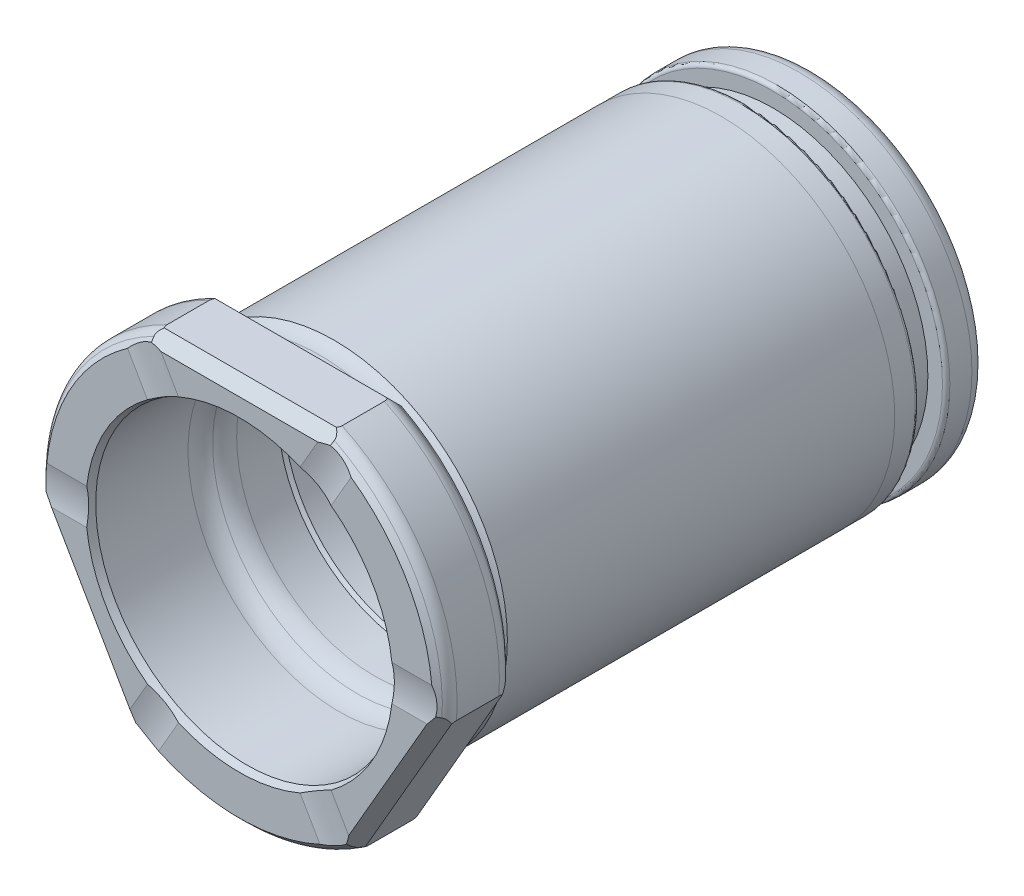
from build123d import *

# Parameters (mm, degrees)
CUT_EXTRUDE1_REACH = 89.606
SKETCH2_R          = 10
CIRPATTERN1_COUNT  = 6
CUT_EXTRUDE2_REACH = 89.606
SKETCH3_W          = 30
SKETCH3_H          = 4
CIRPATTERN2_COUNT  = 3
CHAMFER1_SIZE      = 1.5


with BuildPart() as part:
    # Sketch1 → Revolve1 (revolve)
    with BuildSketch(Plane(origin=(0, 0, 0), x_dir=(0, 0, -1), z_dir=(1, 0, 0)), mode=Mode.PRIVATE) as revolve1_sk:
        with BuildLine():
            Line((0, 26.25), (0, 20.863970234))
            Line((0, 20.863970234), (1, 20.5))
            Line((1, 20.5), (13.53731556, 20.5))
            ThreePointArc((13.53731556, 20.5), (14.84374197, 20.269832382), (16.003050742, 19.625060896))
            ThreePointArc((16.003050742, 19.625060896), (17.125121656, 18.993710669), (18.38963394, 18.751522873))
            Line((18.38963394, 18.751522873), (24, 18.751522873))
            Line((24, 18.751522873), (24.539392542, 18.5))
            Line((24.539392542, 18.5), (58.999857479, 18.5))
            ThreePointArc((58.999857479, 18.5), (59.853654168, 18.853654168), (59.5, 17.999857479))
            Line((59.5, 17.999857479), (59.5, 15.8))
            Line((59.5, 15.8), (61, 15.8))
            Line((61, 15.8), (61, 15.15))
            Line((61, 15.15), (62.5, 15.15))
            Line((62.5, 15.15), (62.5, 18.75))
            Line((62.5, 18.75), (65.7, 18.75))
            Line((65.7, 18.75), (65.7, 15.15))
            Line((65.7, 15.15), (68.5, 15.15))
            Line((68.5, 15.15), (68.5, 18.5))
            Line((68.5, 18.5), (73.5, 18.5))
            Line((73.5, 18.5), (73.5, 15.8))
            Line((73.5, 15.8), (76, 15.8))
            Line((76, 15.8), (76.55, 15.25))
            Line((76.55, 15.25), (78.5, 15.25))
            Line((78.5, 15.25), (78.5, 20))
            Line((78.5, 20), (78, 20))
            Line((78, 20), (78, 21.48))
            ThreePointArc((78, 21.48), (77.414213562, 22.894213562), (76, 23.48))
            Line((76, 23.48), (73, 23.48))
            ThreePointArc((73, 23.48), (72.646446609, 23.333553391), (72.5, 22.98))
            Line((72.5, 22.98), (72.5, 21))
            Line((72.5, 21), (68.8, 21))
            Line((68.8, 21), (68.8, 22.98))
            ThreePointArc((68.8, 22.98), (68.653553391, 23.333553391), (68.3, 23.48))
            Line((68.3, 23.48), (65.5, 23.48))
            Line((65.5, 23.48), (65.5, 23.5))
            Line((65.5, 23.5), (12.9, 23.5))
            ThreePointArc((12.9, 23.5), (11.976346688, 22.94375696), (10.915686517, 22.75))
            Line((10.915686517, 22.75), (10.055, 22.75))
            ThreePointArc((10.055, 22.75), (9.65832333, 22.945619285), (9.572037087, 23.379409523))
            Line((9.572037087, 23.379409523), (9.9, 24.603383777))
            Line((9.9, 24.603383777), (9.9, 26.25))
            Line((9.9, 26.25), (9.235786438, 26.914213562))
            ThreePointArc((9.235786438, 26.914213562), (8.58693974, 27.347759065), (7.821572875, 27.5))
            Line((7.821572875, 27.5), (2.078427125, 27.5))
            ThreePointArc((2.078427125, 27.5), (1.31306026, 27.347759065), (0.664213562, 26.914213562))
            Line((0.664213562, 26.914213562), (0, 26.25))
        make_face()
    revolve(revolve1_sk.sketch.rotate(Axis((0, 0, 0), (0, 0, -1)), 90), axis=Axis((0, 0, 0), (0, 0, -1)))

    # Cut-Extrude1: up to this cone (the profile starts inside it)
    cut_extrude1_end = Plane(origin=(0, 0, 9.7), z_dir=(0, 0, -1)).offset(-16.549999) * Cone(1e-06, 123.206, 123.205999, align=(Align.CENTER, Align.CENTER, Align.MIN), mode=Mode.PRIVATE)
    # Sketch2 → Cut-Extrude1 (cut, up to the surface)
    with BuildSketch(Plane(origin=(0, 0, 0), x_dir=(0, 0, -1), z_dir=(1, 0, 0)), mode=Mode.PRIVATE) as cut_extrude1_sk1:
        with Locations((-9.7, 0)):
            Circle(SKETCH2_R)
    cut_extrude1_tool1 = extrude(cut_extrude1_sk1.sketch, amount=-CUT_EXTRUDE1_REACH, mode=Mode.PRIVATE) & cut_extrude1_end
    cut_extrude1 = cut_extrude1_tool1.solids().sort_by_distance((0, 0, 9.7))[0]
    add(cut_extrude1, mode=Mode.SUBTRACT)

    # CirPattern1: Cut-Extrude1 ×6 about axis
    cirpattern1_axis = Axis((0, 0, 0), (0, 0, 1))
    for i in range(1, CIRPATTERN1_COUNT):
        add(cut_extrude1.rotate(cirpattern1_axis, i * 360 / CIRPATTERN1_COUNT), mode=Mode.SUBTRACT)

    # Sketch3 → Cut-Extrude2 (cut, up to next)
    with BuildSketch(Plane.XY, mode=Mode.PRIVATE) as cut_extrude2_sk1:
        with Locations((0, 26.8)):
            Rectangle(SKETCH3_W, SKETCH3_H)
    cut_extrude2_tool1 = extrude(cut_extrude2_sk1.sketch, amount=-CUT_EXTRUDE2_REACH, mode=Mode.PRIVATE) & part.part
    cut_extrude2 = cut_extrude2_tool1.solids().sort_by_distance((0, 26.8, 0))[0]
    add(cut_extrude2, mode=Mode.SUBTRACT)

    # CirPattern2: Cut-Extrude2 ×3 about axis
    cirpattern2_axis = Axis((0, 0, 0), (0, 0, 1))
    for i in range(1, CIRPATTERN2_COUNT):
        add(cut_extrude2.rotate(cirpattern2_axis, i * 360 / CIRPATTERN2_COUNT), mode=Mode.SUBTRACT)

    # Chamfer1
    # the kernel refuses this chamfer: 1.5 mm, written as the material it takes off along each edge
    with BuildSketch(Plane(origin=(-27.708008732, -1.6083211, -9.9), x_dir=(0.8656979742248804, 0.49981095845564816, -0.027495876610586795), z_dir=(0.49999999999999983, -0.8660254037844388, 0)), Plane(origin=(15.246851296, -23.1916789, -9.9), x_dir=(-0.86569797422488, 0.49981095845564877, -0.02749587661058676), z_dir=(0.5000000000000004, 0.8660254037844384, 0)), Plane(origin=(12.461157436, 24.8, -9.9), x_dir=(0, -0.9996219169112965, -0.02749587661058676), z_dir=(-1, 0, 0))) as chamfer1_piece_1:
        Polygon((CHAMFER1_SIZE * 0.999621916911, CHAMFER1_SIZE * 0.0274958766106), (-CHAMFER1_SIZE * 0.0274958766106, CHAMFER1_SIZE * 0.999621916911), (0, 0), align=None)
    extrude(amount=24.922314871, mode=Mode.SUBTRACT)
    with BuildSketch(Plane(origin=(27.708008732, -1.6083211, 0), x_dir=(0.023812127644089437, -0.013747938305292784, -0.9996219169112968), z_dir=(-0.5000000000000004, -0.8660254037844384, 0)), Plane(origin=(-15.246851296, -23.1916789, 0), x_dir=(-0.023812127644090488, -0.013747938305293366, -0.9996219169112968), z_dir=(-0.49999999999999983, 0.8660254037844388, 0)), Plane(origin=(-12.461157436, 24.8, 0), x_dir=(0, 0.027495876610586778, -0.9996219169112968), z_dir=(1, 0, 0))) as chamfer1_piece_2:
        Polygon((CHAMFER1_SIZE * 0.999621916911, -CHAMFER1_SIZE * 0.0274958766106), (-CHAMFER1_SIZE * 0.0274958766106, -CHAMFER1_SIZE * 0.999621916911), (0, 0), align=None)
    extrude(amount=24.922314871, mode=Mode.SUBTRACT)


solid = part.part
